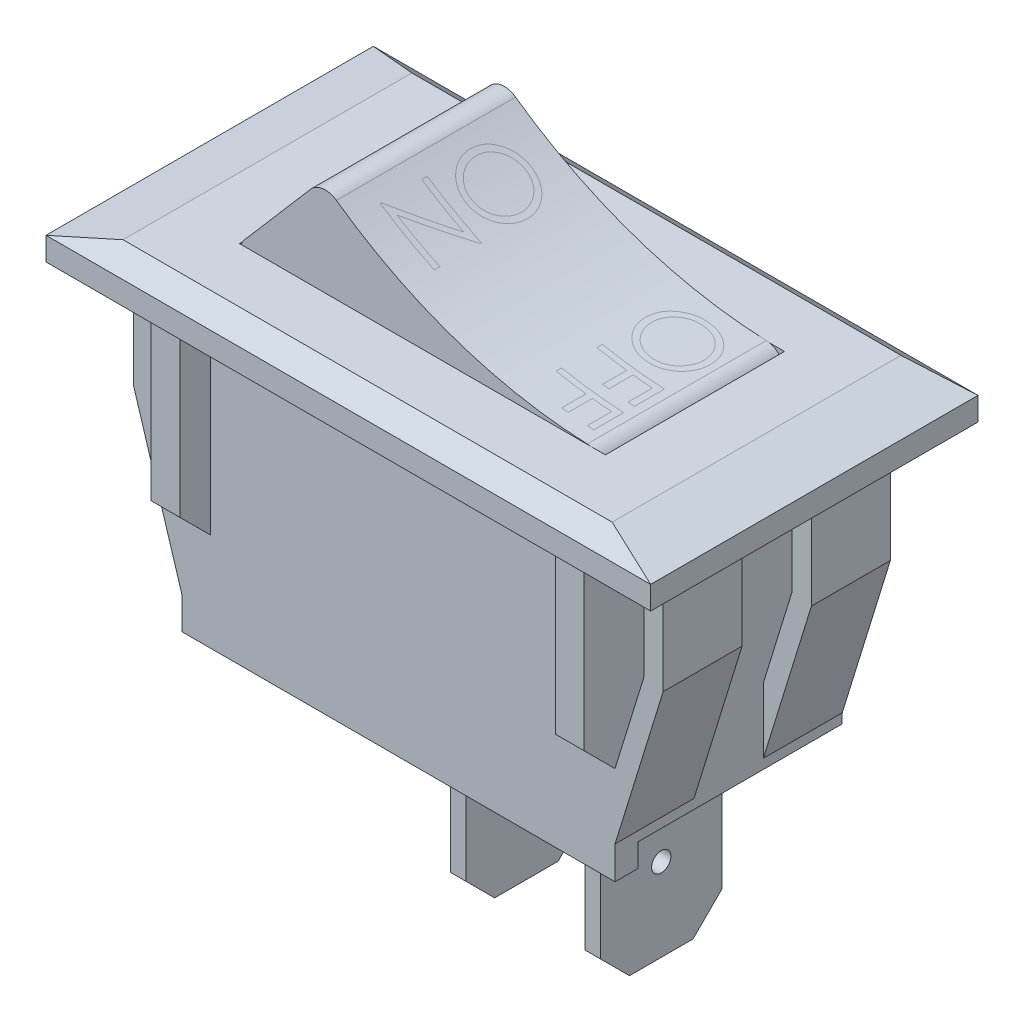
from build123d import *
from OCP.BRepFilletAPI import BRepFilletAPI_MakeChamfer

# Parameters (mm, degrees)
SKETCH1_W            = 22.5
SKETCH1_H            = 14.5
BOSS_EXTRUDE1_DEPTH  = 5.9
EXTRUDE_THIN1_DEPTH  = 5.9
SKETCH3_W            = 3.6
SKETCH3_H            = 13.5
CUT_EXTRUDE1_DEPTH   = 2.5
SKETCH4_W            = 31.4
SKETCH4_H            = 17
BOSS_EXTRUDE2_DEPTH  = 2
RIB1_START           = -1.5
RIB1_DEPTH           = 1.5
MIRROR3_START        = -1.5
MIRROR3_COPY_1_DEPTH = 1.5
CHAMFER1_SIZE        = 0.8
CHAMFER1_SIZE2       = 3
CHAMFER2_SIZE        = 0.8
CHAMFER2_SIZE2       = 1
SKETCH6_W            = 1.2
SKETCH6_H            = 1.2
BOSS_EXTRUDE3_DEPTH  = 22.5
SKETCH8_W            = 19
SKETCH8_H            = 9.3
CUT_EXTRUDE2_DEPTH   = 2
BOSS_EXTRUDE4_DEPTH  = 4.65
FILLET1_R            = 1
SKETCH11_W           = 0.8
SKETCH11_H           = 9.3
BOSS_EXTRUDE5_DEPTH  = 3.15
SKETCH12_R           = 0.5
CUT_EXTRUDE3_DEPTH   = 33.698713079
CHAMFER3_SIZE        = 1.5


# Read off the part's stored shape, not the designer's step: Rib1
with BuildPart() as part:
    # Sketch1 → Boss-Extrude1 (new, symmetric)
    with BuildSketch(Plane.XY):
        with Locations((0, 7.25)):
            Rectangle(SKETCH1_W, SKETCH1_H)
    extrude(amount=BOSS_EXTRUDE1_DEPTH, both=True)

    # Sketch2 → Extrude-Thin1 (add, symmetric)
    with BuildSketch(Plane.XY):
        Polygon((11.25, 0.5), (13.75, 8.6), (13.75, 14), (12.75, 14), (12.75, 8.750811112), (10.294476412, 0.794914688), align=None)
    extrude_thin1 = extrude(amount=EXTRUDE_THIN1_DEPTH, both=True)

    # Sketch3 → Cut-Extrude1 (cut)
    with BuildSketch(Plane(origin=(13.75, 0, 0), x_dir=(0, 0, -1), z_dir=(1, 0, 0))):
        with Locations((0, 7.25)):
            Rectangle(SKETCH3_W, SKETCH3_H)
    cut_extrude1 = extrude(amount=-CUT_EXTRUDE1_DEPTH, mode=Mode.SUBTRACT)

    # Mirror1: Extrude-Thin1, Cut-Extrude1 across plane
    add(extrude_thin1.mirror(Plane(origin=(0, 0, 0), x_dir=(0, 0, 1), z_dir=(1, 0, 0))))
    add(cut_extrude1.mirror(Plane(origin=(0, 0, 0), x_dir=(0, 0, 1), z_dir=(1, 0, 0))), mode=Mode.SUBTRACT)

    # Sketch4 → Boss-Extrude2 (add)
    with BuildSketch(Plane(origin=(0, 14.5, 0), x_dir=(1, 0, 0), z_dir=(0, 1, 0))):
        Rectangle(SKETCH4_W, SKETCH4_H)
    extrude(amount=BOSS_EXTRUDE2_DEPTH)

    # Rib1 outline → Rib1 (add)
    with BuildSketch(Plane.ZY.offset(11.25).offset(RIB1_START)):
        Polygon((-7.5, 14.5), (-7.5, 5.490811112), (-5.9, 3.890811112), (-5.9, 14.5), align=None)
    rib1 = extrude(amount=RIB1_DEPTH)

    # Mirror2: Rib1 across plane
    add(rib1.mirror(Plane(origin=(0, 0, 0), x_dir=(0, 0, 1), z_dir=(1, 0, 0))))

    # Mirror3: Rib1 across plane
    add(rib1.mirror(Plane.XY))

    # Mirror3 copy 1 sketch → Mirror3 copy 1 (add)
    with BuildSketch(Plane(origin=(11.25, 0, 0), x_dir=(0, 0, -1), z_dir=(1, 0, 0)).offset(MIRROR3_START)):
        Polygon((-7.5, 14.5), (-7.5, 5.490811112), (-5.9, 3.890811112), (-5.9, 14.5), align=None)
    extrude(amount=MIRROR3_COPY_1_DEPTH)

    # Chamfer1: one chamfer whose edges measure the first distance from different faces: ONE call of the kernel's chamfer builder (chamfer() names one face for all edges)
    chamfer1_edges_1 = [part.edges().sort_by_distance(p)[0] for p in [
        (15.7, 16.5, 0),
    ]]
    chamfer1_side_1 = [part.faces().sort_by_distance(p)[0] for p in [
        (15.7, 15.5, 0),
    ]]
    chamfer1_edges_2 = [part.edges().sort_by_distance(p)[0] for p in [
        (-15.7, 16.5, 0),
    ]]
    chamfer1_side_2 = [part.faces().sort_by_distance(p)[0] for p in [
        (-15.7, 15.5, 0),
    ]]
    chamfer1 = BRepFilletAPI_MakeChamfer(part.part.solid().wrapped)
    for e in chamfer1_edges_1:
        chamfer1.Add(CHAMFER1_SIZE, CHAMFER1_SIZE2, e.wrapped, chamfer1_side_1[0].wrapped)  # the first distance lies on this face
    for e in chamfer1_edges_2:
        chamfer1.Add(CHAMFER1_SIZE, CHAMFER1_SIZE2, e.wrapped, chamfer1_side_2[0].wrapped)  # the first distance lies on this face
    add(Compound.cast(chamfer1.Shape()), mode=Mode.REPLACE)

    # Chamfer2: one chamfer whose edges measure the first distance from different faces: ONE call of the kernel's chamfer builder (chamfer() names one face for all edges)
    chamfer2_edges_1 = [part.edges().sort_by_distance(p)[0] for p in [
        (0, 16.5, -8.5),
    ]]
    chamfer2_side_1 = [part.faces().sort_by_distance(p)[0] for p in [
        (0, 15.470860927, -8.5),
    ]]
    chamfer2_edges_2 = [part.edges().sort_by_distance(p)[0] for p in [
        (0, 16.5, 8.5),
    ]]
    chamfer2_side_2 = [part.faces().sort_by_distance(p)[0] for p in [
        (0, 15.470860927, 8.5),
    ]]
    chamfer2 = BRepFilletAPI_MakeChamfer(part.part.solid().wrapped)
    for e in chamfer2_edges_1:
        chamfer2.Add(CHAMFER2_SIZE, CHAMFER2_SIZE2, e.wrapped, chamfer2_side_1[0].wrapped)  # the first distance lies on this face
    for e in chamfer2_edges_2:
        chamfer2.Add(CHAMFER2_SIZE, CHAMFER2_SIZE2, e.wrapped, chamfer2_side_2[0].wrapped)  # the first distance lies on this face
    add(Compound.cast(chamfer2.Shape()), mode=Mode.REPLACE)

    # Sketch6 → Boss-Extrude3 (add)
    with BuildSketch(Plane(origin=(11.25, 0, 0), x_dir=(0, 0, -1), z_dir=(1, 0, 0))):
        with Locations((-5.3, -0.6)):
            Rectangle(SKETCH6_W, SKETCH6_H)
    extrude(amount=-BOSS_EXTRUDE3_DEPTH)

    # Sketch8 → Cut-Extrude2 (cut)
    with BuildSketch(Plane(origin=(0, 16.5, 0), x_dir=(1, 0, 0), z_dir=(0, 1, 0))):
        Rectangle(SKETCH8_W, SKETCH8_H)
    extrude(amount=-CUT_EXTRUDE2_DEPTH, mode=Mode.SUBTRACT)

    # Sketch11 → Boss-Extrude5 (add, symmetric)
    with BuildSketch(Plane.XY):
        with Locations((7.35, -4.65)):
            Rectangle(SKETCH11_W, SKETCH11_H)
        with Locations((0.35, -4.65)):
            Rectangle(SKETCH11_W, SKETCH11_H)
    extrude(amount=BOSS_EXTRUDE5_DEPTH, both=True)

    # Sketch12 → Cut-Extrude3 (cut, through all)
    with BuildSketch(Plane(origin=(7.75, 0, 0), x_dir=(0, 0, -1), z_dir=(1, 0, 0))):
        with Locations(Location((0, -5, 0), (0, 0, 90))):
            Circle(SKETCH12_R)
    extrude(amount=-CUT_EXTRUDE3_DEPTH, mode=Mode.SUBTRACT)

    # Chamfer3
    chamfer3_edges = [part.edges().sort_by_distance(p)[0] for p in [
        (7.35, -9.3, -3.15),
        (7.35, -9.3, 3.15),
        (0.35, -9.3, -3.15),
        (0.35, -9.3, 3.15),
    ]]
    chamfer(chamfer3_edges, length=CHAMFER3_SIZE)


with BuildPart() as body_2:
    # Sketch7 → Boss-Extrude4 (new, symmetric)
    with BuildSketch(Plane.XY):
        with BuildLine():
            Line((-9.5, 16.5), (-5.2, 21.5))
            ThreePointArc((-5.2, 21.5), (1.736463435, 17.784202498), (9.5, 16.5))
            Line((9.5, 16.5), (9.5, 15.7))
            Line((9.5, 15.7), (-9.5, 15.7))
            Line((-9.5, 15.7), (-9.5, 16.5))
        make_face()
    extrude(amount=BOSS_EXTRUDE4_DEPTH, both=True)

    # Fillet1
    # the kernel refuses this fillet: 1 mm, written as the material it takes off along each edge
    with BuildSketch(Plane(origin=(-5.2, 21.5, 6.972403822), x_dir=(-0.6520392688280461, -0.7581851963116841, 0), z_dir=(0, 0, -1))) as fillet1_piece_1:
        with BuildLine():
            CenterArc((0.928961529, -1), FILLET1_R, 90, 84.711084934)
            Line((-0.066781022, -0.907822056), (-0.086695873, -0.905978497))
            ThreePointArc((-0.086695873, -0.905978497), (-0.049051695, -0.452758963), (-0.01997025, 0.001090461))
            Line((-0.01997025, 0.001090461), (0, 0.02))
            Line((0, 0.02), (0.928961529, 0.02))
            Line((0.928961529, 0.02), (0.928961529, 0))
        make_face()
    extrude(amount=13.944807644, mode=Mode.SUBTRACT)
    with BuildSketch(Plane(origin=(9.5, 16.5, 7.011358723), x_dir=(0, -1, 0), z_dir=(0, 0, -1))) as fillet1_piece_2:
        with BuildLine():
            CenterArc((0.980729857, 0.983532775), FILLET1_R, 182.244880221, 77.34284501)
            Line((-0.018502684, 0.944362247), (-0.038487335, 0.943578837))
            ThreePointArc((-0.038487335, 0.943578837), (-0.024622277, 0.471879964), (-0.02, 0))
            Line((-0.02, 0), (0, -0.02))
            ThreePointArc((0, -0.02), (0.4, -0.02), (0.796385403, -0.019670655))
            Line((0.796385403, -0.019670655), (0.8, 0))
        make_face()
    extrude(amount=14.022717447, mode=Mode.SUBTRACT)
    with BuildSketch(Plane(origin=(-9.5, 16.5, -5.577148161), x_dir=(0.6520392688280474, 0.7581851963116831, 0), z_dir=(0, 0, 1))) as fillet1_piece_3:
        with BuildLine():
            CenterArc((FILLET1_R * 0.370859264539, -FILLET1_R), FILLET1_R, 90, 40.695531039)
            Line((-FILLET1_R * 0.281180004289, -FILLET1_R * 0.241814803688), (-FILLET1_R * 0.294220789665, -FILLET1_R * 0.226651099762))
            Line((-FILLET1_R * 0.294220789665, -FILLET1_R * 0.226651099762), (-FILLET1_R * 0.00741718529078, FILLET1_R * 0.02))
            Line((-FILLET1_R * 0.00741718529078, FILLET1_R * 0.02), (FILLET1_R * 0.370859264539, FILLET1_R * 0.02))
            Line((FILLET1_R * 0.370859264539, FILLET1_R * 0.02), (FILLET1_R * 0.370859264539, 0))
        make_face()
    extrude(amount=11.154296323, mode=Mode.SUBTRACT)


solid = Compound([part.part, body_2.part])
